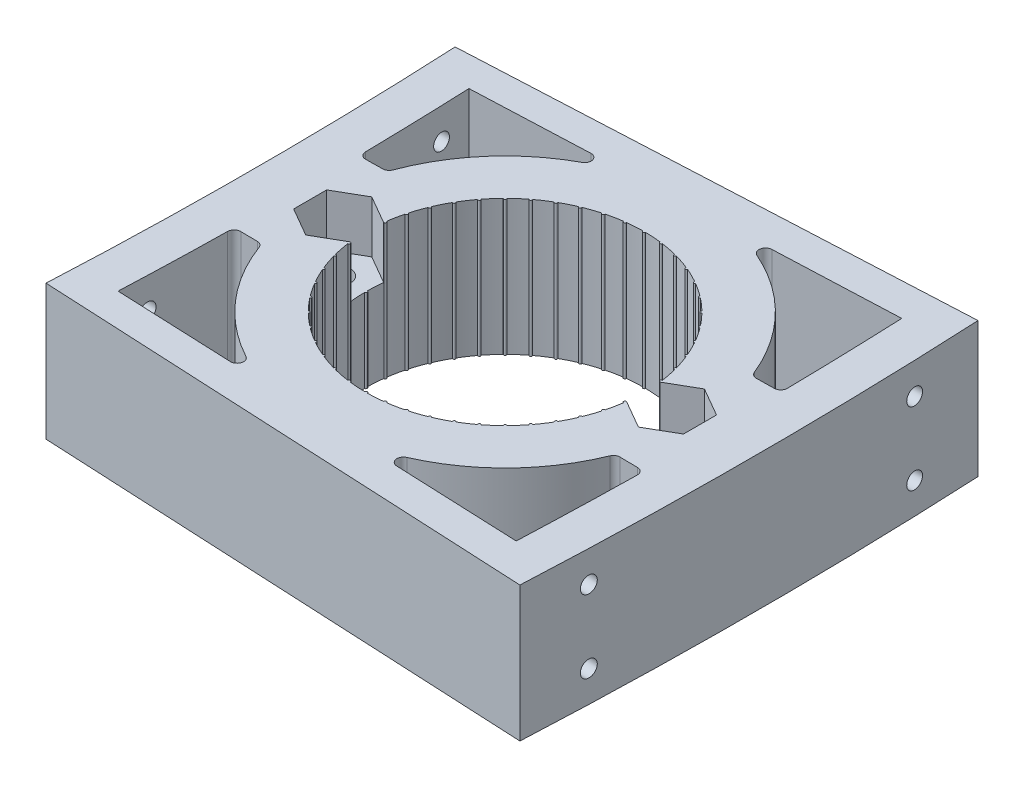
from build123d import *

# Parameters (mm, degrees)
TRACKTOP_DEPTH                 = 20.6375
MOUNTINGHOLES_DEPTH            = 714.9756882640398
MOUNTINGHOLES_DEPTH_BACK       = 714.9756882640398
SKETCH6_R                      = 1.8287999999999822
SKETCH7_R                      = 21.250000000000025
CUT_EXTRUDE1_DEPTH             = 714.9756882640398
SKETCH15_R                     = 0.19999999999998663
BOSS_EXTRUDE1_DEPTH            = 20.6375
CIRPATTERN1_COUNT              = 48
CUT_EXTRUDE2_DEPTH             = 7.9375
CUT_EXTRUDE5_DEPTH             = 714.9756882640398
FILLET1_R                      = 1
CUT_EXTRUDE3_REACH             = 99.789
SKETCH10_R                     = 1.2500000000000004
SKETCH10_R_2                   = 1.2500000000000002
CUT_EXTRUDE3_DIRECTION_2_DEPTH = 98.78939835537156
CUT_EXTRUDE6_REACH             = 101.326
SKETCH14_R                     = 1.2500000000000007
SKETCH14_R_2                   = 1.2500000000000002
CUT_EXTRUDE6_DIRECTION_2_DEPTH = 100.32564032940743


with BuildPart() as part:
    # Sketch1 → TrackTop (new body)
    with BuildSketch(Plane(origin=(0, 0, 0), x_dir=(1, 0, 0), z_dir=(0, 1, 0))):
        with BuildLine():
            Line((635.8529359711115, 31.23745166092525), (711.9611497339457, 34.976408444674234))
            ThreePointArc((711.9611497339457, 34.976408444674234), (712.8197723675814, 0), (711.9611497339457, -34.976408444674234))
            Line((711.9611497339457, -34.976408444674234), (635.8529359711115, -31.23745166092525))
            ThreePointArc((635.8529359711115, -31.23745166092525), (636.6197723675813, 0), (635.8529359711115, 31.23745166092525))
        make_face()
    extrude(amount=TRACKTOP_DEPTH)

    # Sketch6 → MountingHoles (cut, two sides: drawn at the far end of the back side and taken through both)
    with BuildSketch(Plane(origin=(0, 0, 0), x_dir=(1, 0, 0), z_dir=(0, 1, 0)).offset(-MOUNTINGHOLES_DEPTH_BACK)):
        with Locations(Location((649.3197723675815, 7.8e-16, 0), (0, 0, 270))):
            Circle(SKETCH6_R)
        with Locations(Location((700.1197723675814, 1.322e-14, 0), (0, 0, 270))):
            Circle(SKETCH6_R)
    extrude(amount=MOUNTINGHOLES_DEPTH + MOUNTINGHOLES_DEPTH_BACK, mode=Mode.SUBTRACT)

    # Sketch7 → Cut-Extrude1 (cut, through all)
    with BuildSketch(Plane(origin=(0, 20.6375, 0), x_dir=(1, 0, 0), z_dir=(0, 1, 0))):
        with Locations(Location((674.7197723675813, 0, 0), (0, 0, 270))):
            Circle(SKETCH7_R)
    extrude(amount=-CUT_EXTRUDE1_DEPTH, mode=Mode.SUBTRACT)

    # Sketch15 → Boss-Extrude1 (add)
    with BuildSketch(Plane(origin=(0, 0, 0), x_dir=(1, 0, 0), z_dir=(0, 1, 0))):
        with Locations((674.7197723675813, 21.250000000000025)):
            Circle(SKETCH15_R)
    boss_extrude1 = extrude(amount=BOSS_EXTRUDE1_DEPTH)

    # CirPattern1: Boss-Extrude1 ×48 about axis
    cirpattern1_axis = Axis((674.7197723675814, 0, -2.21e-15), (0, 1, 0))
    for i in range(1, CIRPATTERN1_COUNT):
        add(boss_extrude1.rotate(cirpattern1_axis, i * 360 / CIRPATTERN1_COUNT))

    # Sketch8 → Cut-Extrude2 (cut)
    with BuildSketch(Plane(origin=(0, 20.6375, 0), x_dir=(1, 0, 0), z_dir=(0, 1, 0))):
        Polygon((653.6853973675816, -2.520494768930969), (653.6853973675816, 2.5204947689308304), (649.3197723675815, 5.040989537861802), (644.9541473675816, 2.5204947689308708), (644.9541473675816, -2.520494768930888), (649.3197723675817, -5.040989537861881), align=None)
        Polygon((704.4853973675815, -2.520494768930942), (704.4853973675815, 2.520494768930908), (700.1197723675813, 5.040989537862035), (695.7541473675813, 2.5204947689310675), (695.7541473675813, -2.520494768930885), (700.1197723675814, -5.040989537861961), align=None)
    extrude(amount=-CUT_EXTRUDE2_DEPTH, mode=Mode.SUBTRACT)

    # Sketch13 → Cut-Extrude5 (cut, through all)
    with BuildSketch(Plane(origin=(0, 20.6375, 0), x_dir=(1, 0, 0), z_dir=(0, 1, 0))):
        with BuildLine():
            ThreePointArc((647.1520330629523, -9.588008441903805), (654.299172424281, -20.854478037239094), (665.7133953625557, -27.76320099508245))
            Line((665.7133953625557, -27.76320099508245), (642.4113549175614, -26.79140256504246))
            ThreePointArc((642.4113549175614, -26.79140256504246), (642.7132707532777, -18.159839648056288), (642.8992164821943, -9.525))
            Line((642.8992164821943, -9.525), (647.1520330629523, -9.588008441903805))
        make_face()
        with BuildLine():
            Line((642.8992164821943, 9.525), (647.1520330629523, 9.588008441903805))
            ThreePointArc((647.1520330629523, 9.588008441903805), (654.299172424281, 20.854478037239094), (665.7133953625557, 27.76320099508245))
            Line((665.7133953625557, 27.76320099508245), (642.4113549175614, 26.79140256504246))
            ThreePointArc((642.4113549175614, 26.79140256504246), (642.7132707532778, 18.15983964805629), (642.8992164821943, 9.525))
        make_face()
        with BuildLine():
            ThreePointArc((701.9913681146363, 10.400491414313457), (693.9302481134886, 21.9742526122256), (681.3831982927668, 28.416701272131633))
            Line((681.3831982927668, 28.416701272131633), (705.8562053450621, 29.437334202879395))
            ThreePointArc((705.8562053450621, 29.437334202879395), (706.1879385320628, 19.953314033959963), (706.3922483494538, 10.465693522454146))
            Line((706.3922483494538, 10.465693522454146), (701.9913681146363, 10.400491414313457))
        make_face()
        with BuildLine():
            Line((706.3922483494538, -10.465693522454146), (701.9913681146363, -10.400491414313457))
            ThreePointArc((701.9913681146363, -10.400491414313457), (693.9302481134886, -21.9742526122256), (681.3831982927668, -28.416701272131633))
            Line((681.3831982927668, -28.416701272131633), (705.8562053450621, -29.437334202879395))
            ThreePointArc((705.8562053450621, -29.437334202879395), (706.187938532063, -19.953314033959966), (706.3922483494538, -10.465693522454146))
        make_face()
    extrude(amount=-CUT_EXTRUDE5_DEPTH, mode=Mode.SUBTRACT)

    # Fillet1
    fillet1_edges = [part.edges().sort_by_distance(p)[0] for p in [
        (701.9913681146363, 10.31875, 10.400491414313457),
        (706.3922483494537, 10.31875, 10.465693522454146),
        (681.3831982927668, 10.31875, 28.416701272131633),
        (701.9913681146363, 10.31875, -10.400491414313457),
        (681.3831982927668, 10.31875, -28.416701272131633),
        (706.3922483494539, 10.31875, -10.46569352245415),
        (647.1520330629523, 10.31875, -9.588008441903803),
        (642.8992164821943, 10.31875, -9.524999999999999),
        (665.7133953625557, 10.31875, -27.763200995082457),
        (647.1520330629523, 10.31875, 9.588008441903803),
        (665.7133953625557, 10.31875, 27.763200995082457),
        (642.8992164821943, 10.31875, 9.524999999999999),
    ]]
    fillet(fillet1_edges, radius=FILLET1_R)

    # Sketch10 → Cut-Extrude3 (cut, up to next)
    with BuildSketch(Plane(origin=(636.2319608031457, 0, -22.2177096464898), x_dir=(0.034899496702501726, 0, 0.9993908270190958), z_dir=(-0.9993908270190957, 0, 0.03489949670250172)), mode=Mode.PRIVATE) as cut_extrude3_sk1:
        with Locations(Location((0, 15.875, 0), (0, 0, 180))):
            Circle(SKETCH10_R)
    cut_extrude3_tool1 = extrude(cut_extrude3_sk1.sketch, amount=-CUT_EXTRUDE3_REACH, mode=Mode.PRIVATE) & part.part
    # Sketch10 → Cut-Extrude3 (cut, up to next)
    with BuildSketch(Plane(origin=(636.2319608031457, 0, -22.2177096464898), x_dir=(0.034899496702501726, 0, 0.9993908270190958), z_dir=(-0.9993908270190957, 0, 0.03489949670250172)), mode=Mode.PRIVATE) as cut_extrude3_sk2:
        with Locations(Location((2.04e-15, 4.762499999999999, 0), (0, 0, 180))):
            Circle(SKETCH10_R_2)
    cut_extrude3_tool2 = extrude(cut_extrude3_sk2.sketch, amount=-CUT_EXTRUDE3_REACH, mode=Mode.PRIVATE) & part.part
    cut_extrude3_1 = cut_extrude3_tool1.solids().sort_by_distance((636.231961, 15.875, -22.21771))[0]
    add(cut_extrude3_1, mode=Mode.SUBTRACT)
    cut_extrude3_2 = cut_extrude3_tool2.solids().sort_by_distance((636.231961, 4.7625, -22.21771))[0]
    add(cut_extrude3_2, mode=Mode.SUBTRACT)
    cut_extrude3 = cut_extrude3_1 + cut_extrude3_2  # Cut-Extrude3 as one shape, for the pattern or mirror that repeats it

    # Sketch10 → Cut-Extrude3 direction 2 (cut)
    with BuildSketch(Plane(origin=(636.2319608031457, 0, -22.2177096464898), x_dir=(0.034899496702501726, 0, 0.9993908270190958), z_dir=(-0.9993908270190957, 0, 0.03489949670250172))):
        with Locations(Location((0, 15.875, 0), (0, 0, 180))):
            Circle(SKETCH10_R)
        with Locations(Location((2.04e-15, 4.762499999999999, 0), (0, 0, 180))):
            Circle(SKETCH10_R_2)
    cut_extrude3_direction_2 = extrude(amount=CUT_EXTRUDE3_DIRECTION_2_DEPTH, mode=Mode.SUBTRACT)

    # Sketch14 → Cut-Extrude6 (cut, up to next)
    with BuildSketch(Plane(origin=(712.385541822001, 0, -24.87705129522044), x_dir=(-0.03489949670250173, 0, -0.9993908270190958), z_dir=(0.9993908270190957, 0, -0.034899496702501726)), mode=Mode.PRIVATE) as cut_extrude6_sk1:
        with Locations((-3.47e-15, 15.875)):
            Circle(SKETCH14_R)
    cut_extrude6_tool1 = extrude(cut_extrude6_sk1.sketch, amount=-CUT_EXTRUDE6_REACH, mode=Mode.PRIVATE) & part.part
    # Sketch14 → Cut-Extrude6 (cut, up to next)
    with BuildSketch(Plane(origin=(712.385541822001, 0, -24.87705129522044), x_dir=(-0.03489949670250173, 0, -0.9993908270190958), z_dir=(0.9993908270190957, 0, -0.034899496702501726)), mode=Mode.PRIVATE) as cut_extrude6_sk2:
        with Locations((-5.51e-15, 4.762499999999999)):
            Circle(SKETCH14_R_2)
    cut_extrude6_tool2 = extrude(cut_extrude6_sk2.sketch, amount=-CUT_EXTRUDE6_REACH, mode=Mode.PRIVATE) & part.part
    cut_extrude6_1 = cut_extrude6_tool1.solids().sort_by_distance((712.385542, 15.875, -24.877051))[0]
    add(cut_extrude6_1, mode=Mode.SUBTRACT)
    cut_extrude6_2 = cut_extrude6_tool2.solids().sort_by_distance((712.385542, 4.7625, -24.877051))[0]
    add(cut_extrude6_2, mode=Mode.SUBTRACT)
    cut_extrude6 = cut_extrude6_1 + cut_extrude6_2  # Cut-Extrude6 as one shape, for the pattern or mirror that repeats it

    # Sketch14 → Cut-Extrude6 direction 2 (cut)
    with BuildSketch(Plane(origin=(712.385541822001, 0, -24.87705129522044), x_dir=(-0.03489949670250173, 0, -0.9993908270190958), z_dir=(0.9993908270190957, 0, -0.034899496702501726))):
        with Locations((-3.47e-15, 15.875)):
            Circle(SKETCH14_R)
        with Locations((-5.51e-15, 4.762499999999999)):
            Circle(SKETCH14_R_2)
    cut_extrude6_direction_2 = extrude(amount=CUT_EXTRUDE6_DIRECTION_2_DEPTH, mode=Mode.SUBTRACT)

    # Mirror1: Cut-Extrude3, Cut-Extrude3 direction 2, Cut-Extrude6, Cut-Extrude6 direction 2 across plane
    add(cut_extrude3.mirror(Plane.XY), mode=Mode.SUBTRACT)
    add(cut_extrude3_direction_2.mirror(Plane.XY), mode=Mode.SUBTRACT)
    add(cut_extrude6.mirror(Plane.XY), mode=Mode.SUBTRACT)
    add(cut_extrude6_direction_2.mirror(Plane.XY), mode=Mode.SUBTRACT)


solid = part.part
